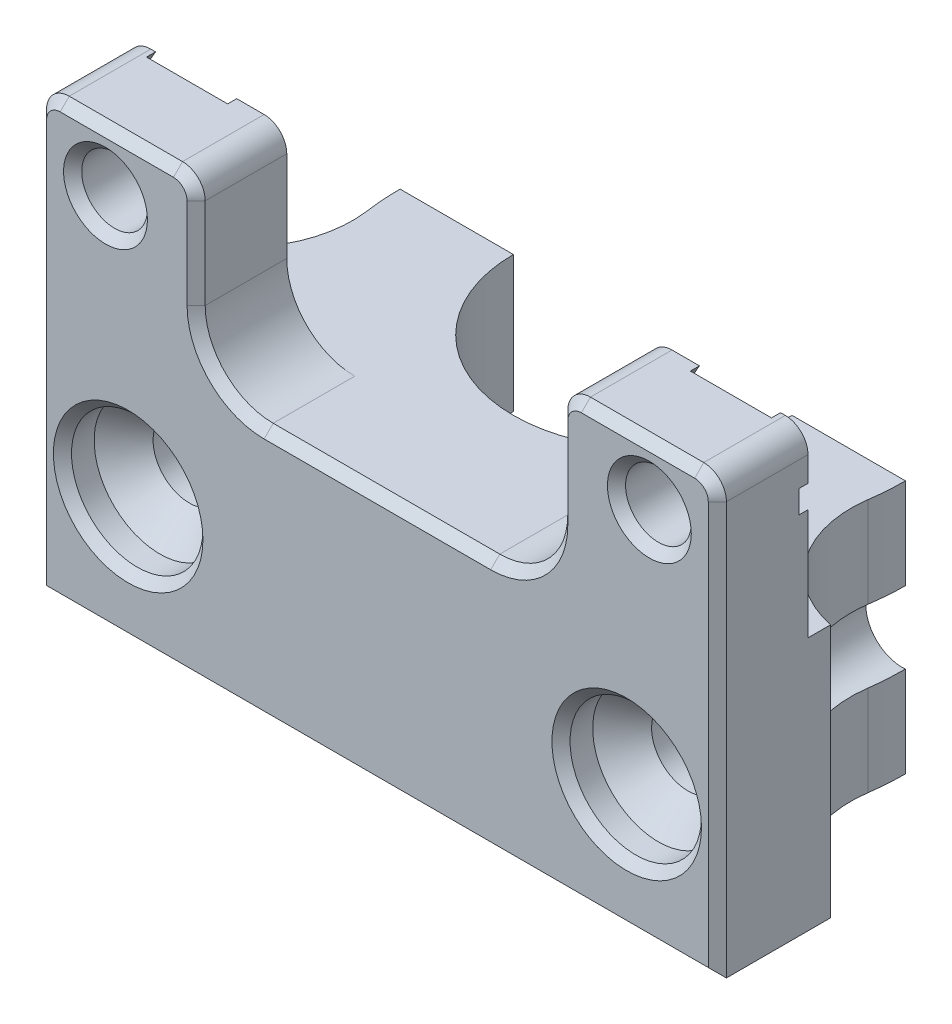
from build123d import *

# Parameters (mm, degrees)
EXTRUDE_1_DEPTH     = 5.2
EXTRUDE_2_DEPTH     = 6
EXTRUDE_START       = -11.2
EXTRUDE_3_DEPTH     = 11.2
FILLET_1_R          = 5
SKETCH_4_R          = 1.6
CUT_EXTRUDE_1_DEPTH = 22.789045413
SKETCH_7_W          = 7
SKETCH_7_H          = 3
EXTRUDE_5_DEPTH     = 8
SKETCH_8_R          = 1.45
CUT_EXTRUDE_3_DEPTH = 8
EXTRUDE_START_2     = 1
SKETCH_9_R          = 1.45
SKETCH_9_R_2        = 1.6
EXTRUDE_6_DEPTH     = 1
FILLET_2_R          = 3
FILLET_3_R          = 1
SKETCH_10_R         = 2.9
CUT_EXTRUDE_4_DEPTH = 2.7
CHAMFER_2_SIZE      = 1.3
CHAMFER_1_SIZE      = 0.4
CUT_EXTRUDE_5_DEPTH = 0.4


# Some blends are built 0.0001 mm under size
with BuildPart() as part:
    # 草图1 → 凸台-拉伸1 (new body)
    with BuildSketch(Plane(origin=(0, 0, 0), x_dir=(1, 0, 0), z_dir=(0, 1, 0))):
        with BuildLine():
            Line((-11.15, 0), (-8.15, 0))
            ThreePointArc((-8.15, 0), (0, -8.15), (8.15, 0))
            Line((8.15, 0), (11.15, 0))
            ThreePointArc((11.15, 0), (0, -11.15), (-11.15, 0))
        make_face()
    extrude(amount=EXTRUDE_1_DEPTH)

    # 草图2 → 凸台-拉伸2 (add)
    with BuildSketch(Plane(origin=(0, 5.2, 0), x_dir=(1, 0, 0), z_dir=(0, 1, 0))):
        with BuildLine():
            Line((-11.15, 0), (-6.15, 0))
            ThreePointArc((-6.15, 0), (0, -6.15), (6.15, 0))
            Line((6.15, 0), (11.15, 0))
            ThreePointArc((11.15, 0), (0, -11.15), (-11.15, 0))
        make_face()
    extrude(amount=EXTRUDE_2_DEPTH)

    # 草图3 → 凸台-拉伸3 (add)
    with BuildSketch(Plane(origin=(0, 11.2, 0), x_dir=(1, 0, 0), z_dir=(0, 1, 0)).offset(EXTRUDE_START)):
        with BuildLine():
            Line((3.911521443, -7.15), (15, -7.15))
            Line((15, -7.15), (15, -11.15))
            Line((15, -11.15), (-15, -11.15))
            Line((-15, -11.15), (-15, -7.15))
            Line((-15, -7.15), (-3.911521443, -7.15))
            ThreePointArc((-3.911521443, -7.15), (0, -8.15), (3.911521443, -7.15))
        make_face()
    extrude(amount=EXTRUDE_3_DEPTH)

    # 圆角1
    # the kernel refuses this fillet: 5 mm, written as the material it adds along each edge
    with BuildSketch(Plane(origin=(-8.555699854, 11.2, 7.15), x_dir=(-0.4058769598957605, 0, -0.9139277287760642), z_dir=(0, -1, 0))) as fillet_1_piece_1:
        with BuildLine():
            CenterArc((7.497147581, -4.807763049), FILLET_1_R, 105.939417034, 86.556633096)
            Line((2.615592952, -5.889624596), (2.517961859, -5.911261826))
            ThreePointArc((2.517961859, -5.911261826), (1.216403703, -2.985399994), (-0.091392773, -0.040587696))
            Line((-0.091392773, -0.040587696), (0.027462079, 0.096155261))
            ThreePointArc((0.027462079, 0.096155261), (3.062021814, -0.328688401), (6.096581549, 0.096155261))
            Line((6.096581549, 0.096155261), (6.124043628, 0))
        make_face()
    extrude(amount=11.2)
    with BuildSketch(Plane(origin=(8.555699854, 11.2, 7.15), x_dir=(1, 0, 0), z_dir=(0, -1, 0))) as fillet_1_piece_2:
        with BuildLine():
            CenterArc((7.436867432, -4.90049081), FILLET_1_R, 101.450043509, 86.556633096)
            Line((2.48560821, -5.596933284), (2.386583026, -5.610862133))
            ThreePointArc((2.386583026, -5.610862133), (1.543201548, -2.665059593), (-0.076732734, -0.064125561))
            Line((-0.076732734, -0.064125561), (0, 0.1))
            ThreePointArc((0, 0.1), (3.222150073, 0.1), (6.4244488, 0.098009816))
            Line((6.4244488, 0.098009816), (6.444300146, 0))
        make_face()
    extrude(amount=11.2)

    # 草图4 → 切除-拉伸1 (cut, through all)
    with BuildSketch(Plane.XY.offset(11.15)):
        with Locations((-11, 5.6)):
            Circle(SKETCH_4_R)
        with Locations((11, 5.6)):
            Circle(SKETCH_4_R)
    extrude(amount=-CUT_EXTRUDE_1_DEPTH, mode=Mode.SUBTRACT)

    # 草图7 → 凸台-拉伸5 (add)
    with BuildSketch(Plane(origin=(0, 11.2, 0), x_dir=(1, 0, 0), z_dir=(0, 1, 0))):
        with Locations((-11.5, -9.65)):
            Rectangle(SKETCH_7_W, SKETCH_7_H)
        with Locations((11.5, -9.65)):
            Rectangle(SKETCH_7_W, SKETCH_7_H)
    extrude(amount=EXTRUDE_5_DEPTH)

    # 草图8 → 切除-拉伸3 (cut)
    with BuildSketch(Plane.XY.offset(11.15)):
        with Locations((-12, 16.6)):
            Circle(SKETCH_8_R)
        with Locations((12, 16.6)):
            Circle(SKETCH_8_R)
    extrude(amount=-CUT_EXTRUDE_3_DEPTH, mode=Mode.SUBTRACT)

    # 草图9 → 凸台-拉伸6 (add)
    with BuildSketch(Plane.XY.offset(11.15).offset(EXTRUDE_START_2)):
        Polygon((-15, 19.2), (-15, 0), (15, 0), (15, 19.2), (8, 19.2), (8, 11.2), (-8, 11.2), (-8, 19.2), align=None)
        with Locations((-12, 16.6)):
            Circle(SKETCH_9_R, mode=Mode.SUBTRACT)
        with Locations((-11, 5.6)):
            Circle(SKETCH_9_R_2, mode=Mode.SUBTRACT)
        with Locations((11, 5.6)):
            Circle(SKETCH_9_R_2, mode=Mode.SUBTRACT)
        with Locations((12, 16.6)):
            Circle(SKETCH_9_R, mode=Mode.SUBTRACT)
    extrude(amount=-EXTRUDE_6_DEPTH)

    # 圆角2
    fillet_2_edges = [part.edges().sort_by_distance(p)[0] for p in [
        (8, 11.2, 10.15),
        (-8, 11.2, 10.15),
    ]]
    fillet(fillet_2_edges, radius=FILLET_2_R)

    # 圆角3
    fillet_3_edges = [part.edges().sort_by_distance(p)[0] for p in [
        (15, 19.2, 10.15),
        (8, 19.2, 10.15),
        (-15, 19.2, 10.15),
        (-8, 19.2, 10.15),
    ]]
    fillet(fillet_3_edges, radius=FILLET_3_R)

    # 草图10 → 切除-拉伸4 (cut)
    with BuildSketch(Plane.XY.offset(12.15)):
        with Locations((-11, 5.6)):
            Circle(SKETCH_10_R)
        with Locations((11, 5.6)):
            Circle(SKETCH_10_R)
    extrude(amount=-CUT_EXTRUDE_4_DEPTH, mode=Mode.SUBTRACT)

    # 倒角2
    chamfer_2_edges = [part.edges().sort_by_distance(p)[0] for p in [
        (-13.9, 5.6, 9.45),
        (8.1, 5.6, 9.45),
    ]]
    chamfer(chamfer_2_edges, length=CHAMFER_2_SIZE - 0.0001)  # a hair under: the kernel refuses the full size

    # 倒角1
    chamfer_1_edges = [part.edges().sort_by_distance(p)[0] for p in [
        (0, 0, 12.15),
        (15, 9.1, 12.15),
        (-13.45, 16.6, 12.15),
        (10.55, 16.6, 12.15),
        (0, 11.2, 12.15),
        (-8, 16.2, 12.15),
        (7.121320344, 12.078679656, 12.15),
        (-7.121320344, 12.078679656, 12.15),
        (11.5, 19.2, 12.15),
        (-11.5, 19.2, 12.15),
        (-15, 9.1, 12.15),
        (8, 16.2, 12.15),
        (-14.707106781, 18.907106781, 12.15),
        (-8.292893219, 18.907106781, 12.15),
        (8.292893219, 18.907106781, 12.15),
        (14.707106781, 18.907106781, 12.15),
        (-13.9, 5.6, 12.15),
        (8.1, 5.6, 12.15),
    ]]
    chamfer(chamfer_1_edges, length=CHAMFER_1_SIZE)

    # 草图11 → 切除-拉伸5 (cut)
    with BuildSketch(Plane(origin=(0, 0, 8.15), x_dir=(-1, 0, 0), z_dir=(0, 0, -1))):
        Polygon((-8.709103466, 16.6), (-10.354551733, 19.45), (-13.645448267, 19.45), (-15.290896534, 16.6), (-13.645448267, 13.75), (-10.354551733, 13.75), align=None)
        Polygon((15.290896534, 16.6), (13.645448267, 19.45), (10.354551733, 19.45), (8.709103466, 16.6), (10.354551733, 13.75), (13.645448267, 13.75), align=None)
    extrude(amount=-CUT_EXTRUDE_5_DEPTH, mode=Mode.SUBTRACT)


solid = part.part
